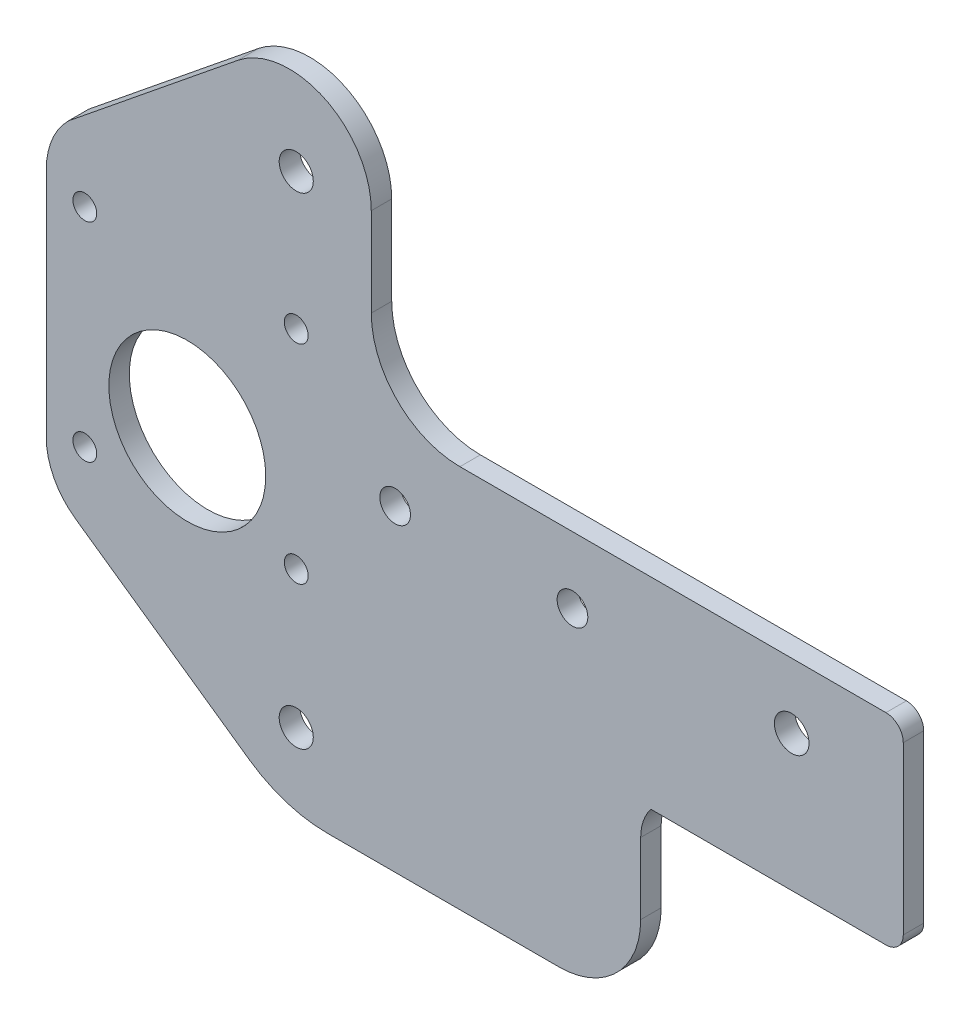
from build123d import *

# Parameters (mm, degrees)
SKETCH1_R           = 2.54
SKETCH1_R_2         = 2.25
SKETCH1_R_3         = 1.75
SKETCH1_R_4         = 2.5
SKETCH1_R_5         = 11.5
BOSS_EXTRUDE1_DEPTH = 3
FILLET2_R           = 2.54


with BuildPart() as part:
    # Sketch1 → Boss-Extrude1 (new body)
    with BuildSketch(Plane.XY):
        with BuildLine():
            Line((0, 0), (0, -29.5))
            Line((0, -29.5), (-37, -29.5))
            ThreePointArc((-37, -29.5), (-38.114378278, -31.538839171), (-38.5, -33.830127019))
            Line((-38.5, -33.830127019), (-38.5, -44.26209895))
            ThreePointArc((-38.5, -44.26209895), (-42.014718626, -52.747380324), (-50.5, -56.26209895))
            Line((-50.5, -56.26209895), (-84.414235636, -56.26209895))
            ThreePointArc((-84.414235636, -56.26209895), (-90.428351627, -55.336437965), (-95.885764364, -52.645139836))
            Line((-95.885764364, -52.645139836), (-121.385764364, -34.789847611))
            ThreePointArc((-121.385764364, -34.789847611), (-124.520108332, -31.215813301), (-125.65, -26.598327168))
            Line((-125.65, -26.598327168), (-125.65, 7.401672832))
            ThreePointArc((-125.65, 7.401672832), (-124.8106021, 11.616191188), (-122.420515459, 15.187499024))
            Line((-122.420515459, 15.187499024), (-97.551844693, 35.325751537))
            ThreePointArc((-97.551844693, 35.325751537), (-84.833866838, 36.831023412), (-78, 26))
            Line((-78, 26), (-78, 13))
            ThreePointArc((-78, 13), (-74.192388155, 3.807611845), (-65, 0))
            Line((-65, 0), (0, 0))
        make_face()
        with Locations((-16.356, -9.552)):
            Circle(SKETCH1_R, mode=Mode.SUBTRACT)
        with Locations((-48.5, -9.75)):
            Circle(SKETCH1_R_2, mode=Mode.SUBTRACT)
        with Locations((-74.5, -9.75)):
            Circle(SKETCH1_R_2, mode=Mode.SUBTRACT)
        with Locations((-89, 5.5)):
            Circle(SKETCH1_R_3, mode=Mode.SUBTRACT)
        with Locations((-89, 25.5)):
            Circle(SKETCH1_R_4, mode=Mode.SUBTRACT)
        with Locations((-89, -25)):
            Circle(SKETCH1_R_3, mode=Mode.SUBTRACT)
        with Locations((-89, -45.112)):
            Circle(SKETCH1_R_4, mode=Mode.SUBTRACT)
        with Locations((-104.975027079, -15.450324944)):
            Circle(SKETCH1_R_5, mode=Mode.SUBTRACT)
        with Locations((-120, 5.5)):
            Circle(SKETCH1_R_3, mode=Mode.SUBTRACT)
        with Locations((-120, -25)):
            Circle(SKETCH1_R_3, mode=Mode.SUBTRACT)
    extrude(amount=BOSS_EXTRUDE1_DEPTH)

    # Fillet2
    fillet2_edges = [part.edges().sort_by_distance(p)[0] for p in [
        (0, 0, 1.5),
        (0, -29.5, 1.5),
    ]]
    fillet(fillet2_edges, radius=FILLET2_R)


solid = part.part
